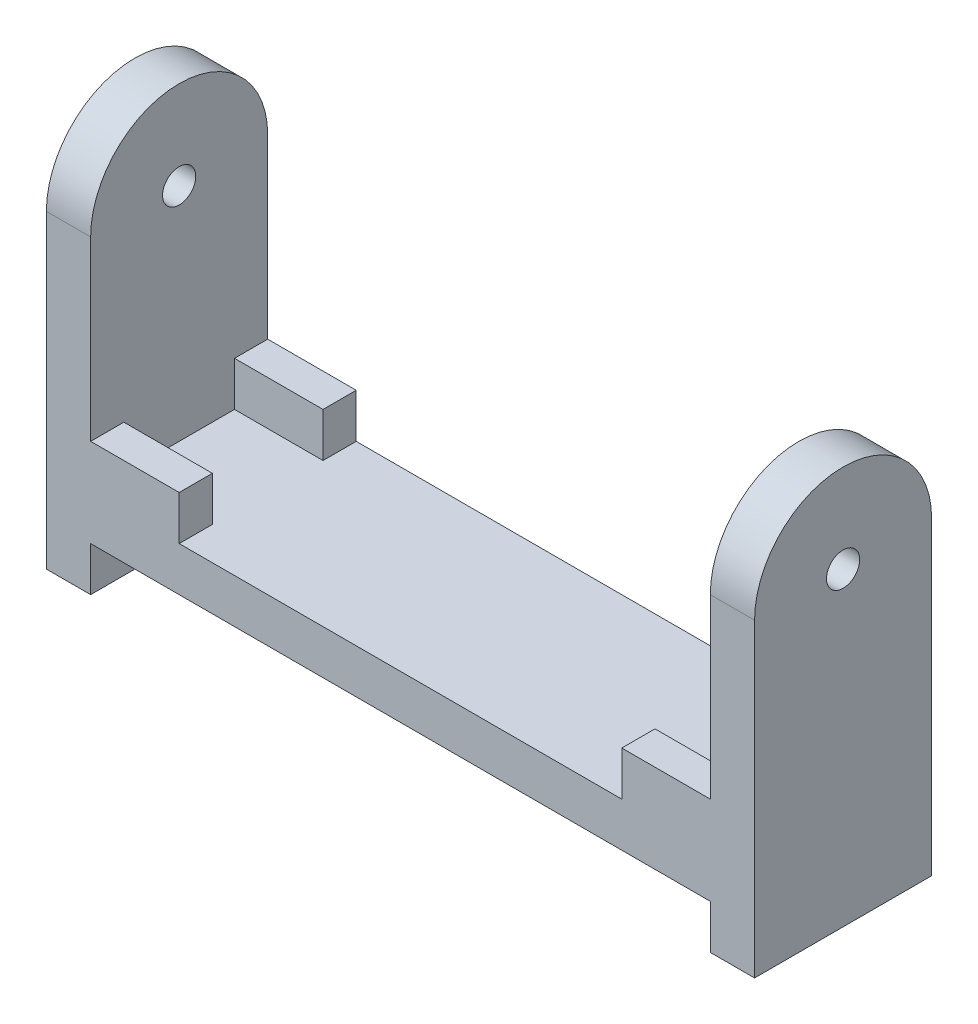
from build123d import *

# Parameters (mm, degrees)
SKETCH_2_R             = 7.5
EXTRUDE_1_DEPTH        = 320
SKETCH_3_W             = 280
SKETCH_3_H             = 140
CUT_EXTRUDE_1_DEPTH    = 351.998575496
SKETCH_4_W             = 20
SKETCH_4_H             = 80
EXTRUDE_2_DEPTH        = 20
SKETCH_5_R             = 5
CUT_EXTRUDE_1283_DEPTH = 20
SKETCH_7_W             = 40
SKETCH_7_H             = 15
EXTRUDE_1635_DEPTH     = 20


with BuildPart() as part:
    # 草圖2 → 填料-伸長1 (new body)
    with BuildSketch(Plane(origin=(0, 0, 0), x_dir=(0, 0, -1), z_dir=(1, 0, 0))):
        with BuildLine():
            Line((-40, 0), (-40, -120))
            Line((-40, -120), (40, -120))
            Line((40, -120), (40, 0))
            ThreePointArc((40, 0), (0, 40), (-40, 0))
        make_face()
        Circle(SKETCH_2_R, mode=Mode.SUBTRACT)
    extrude(amount=EXTRUDE_1_DEPTH)

    # 草圖3 → 除料-伸長1 (cut, through all)
    with BuildSketch(Plane(origin=(0, 0, -40), x_dir=(-1, 0, 0), z_dir=(0, 0, -1))):
        with Locations((-160, -30)):
            Rectangle(SKETCH_3_W, SKETCH_3_H)
    extrude(amount=-CUT_EXTRUDE_1_DEPTH, mode=Mode.SUBTRACT)

    # 草圖4 → 填料-伸長2 (add)
    with BuildSketch(Plane.XZ.offset(120)):
        with Locations((10, 0)):
            Rectangle(SKETCH_4_W, SKETCH_4_H)
        with Locations((310, 0)):
            Rectangle(SKETCH_4_W, SKETCH_4_H)
    extrude(amount=EXTRUDE_2_DEPTH)

    # 草圖5 → Cut-Extrude 1283 (cut)
    with BuildSketch(Plane.XZ.offset(140)):
        with Locations((10, 0)):
            Circle(SKETCH_5_R)
        with Locations((310, 0)):
            Circle(SKETCH_5_R)
    extrude(amount=-CUT_EXTRUDE_1283_DEPTH, mode=Mode.SUBTRACT)

    # 草圖7 → Extrude 1635 (add)
    with BuildSketch(Plane(origin=(0, -100, 0), x_dir=(1, 0, 0), z_dir=(0, 1, 0))):
        with Locations((40, 32.5)):
            Rectangle(SKETCH_7_W, SKETCH_7_H)
        with Locations((40, -32.5)):
            Rectangle(SKETCH_7_W, SKETCH_7_H)
        with Locations((280, -32.5)):
            Rectangle(SKETCH_7_W, SKETCH_7_H)
        with Locations((280, 32.5)):
            Rectangle(SKETCH_7_W, SKETCH_7_H)
    extrude(amount=EXTRUDE_1635_DEPTH)


solid = part.part
